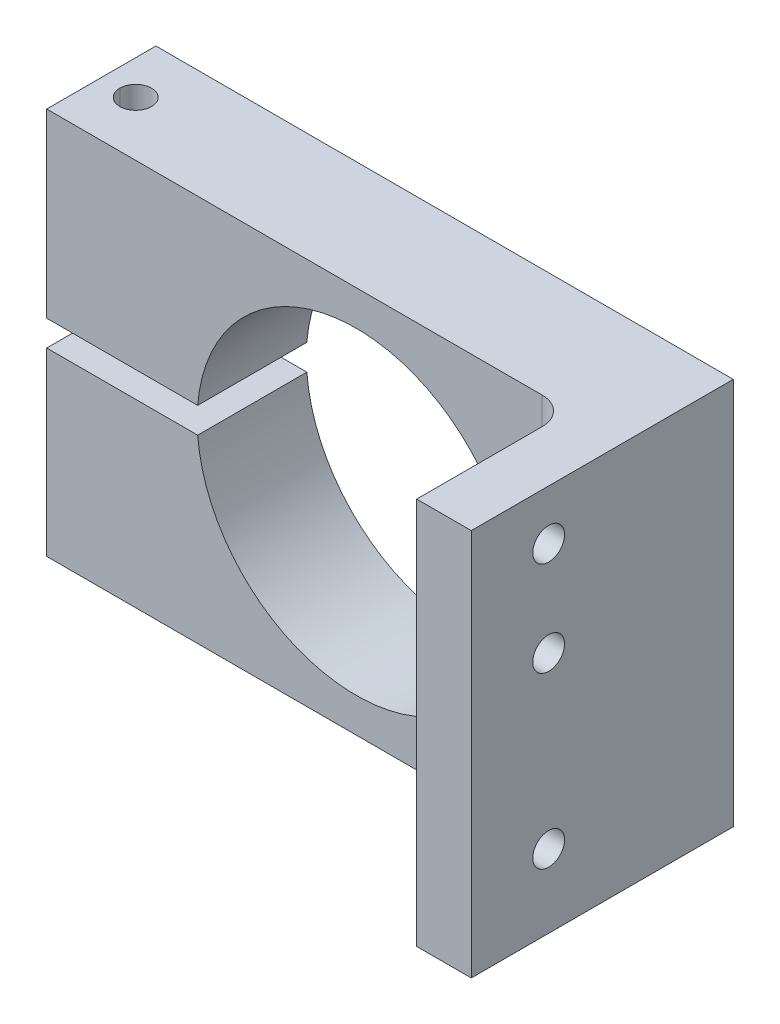
from build123d import *

# Parameters (mm, degrees)
CUT_EXTRUDE1_START       = -22.385915399
CUT_EXTRUDE1_OUTLINE_R   = 1.85
CUT_EXTRUDE1_DEPTH       = 4
CUT_EXTRUDE1_START_2     = -18.385915399
CUT_EXTRUDE1_2_OUTLINE_R = 1.85
CUT_EXTRUDE1_2_DEPTH     = 40.98
CUT_EXTRUDE1_START_3     = -12.299495873
CUT_EXTRUDE1_3_DEPTH     = 12.7
SKETCH2_W                = 30.48
SKETCH2_H                = 44.98
BOSS_EXTRUDE1_DEPTH      = 6.35
CUT_EXTRUDE2_REACH       = 69.384
SKETCH3_R                = 1.85
BOSS_EXTRUDE3_REACH      = 66.446
SKETCH4_W                = 67.174
SKETCH4_H                = 12.7
SKETCH5_W                = 6.35
SKETCH5_H                = 17.78
BOSS_EXTRUDE4_DEPTH      = 0.1
FILLET1_R                = 3.175


with BuildPart() as part:
    # Cut-Extrude1: read off the stored shape, not the designer's step
    # Cut-Extrude1 outline → Cut-Extrude1 (new body)
    with BuildSketch(Plane(origin=(0, 0, 0), x_dir=(1, 0, 0), z_dir=(0, 1, 0)).offset(CUT_EXTRUDE1_START)):
        with BuildLine():
            ThreePointArc((41.290674946, 5.949495873), (41.56736633, 6.922737878), (42.314674946, 7.604858069))
            Line((42.314674946, 7.604858069), (42.314674946, 12.299495873))
            Line((42.314674946, 12.299495873), (-24.859325054, 12.299495873))
            Line((-24.859325054, 12.299495873), (-24.859325054, -0.400504127))
            Line((-24.859325054, -0.400504127), (42.314674946, -0.400504127))
            Line((42.314674946, -0.400504127), (42.314674946, 4.294133677))
            ThreePointArc((42.314674946, 4.294133677), (41.56736633, 4.976253868), (41.290674946, 5.949495873))
        make_face()
        with Locations((-20.859325054, 5.949495873)):
            Circle(CUT_EXTRUDE1_OUTLINE_R, mode=Mode.SUBTRACT)
    extrude(amount=CUT_EXTRUDE1_DEPTH)

    # Cut-Extrude1 2 outline → Cut-Extrude1 2 (add)
    with BuildSketch(Plane(origin=(0, 0, 0), x_dir=(1, 0, 0), z_dir=(0, 1, 0)).offset(CUT_EXTRUDE1_START_2)):
        with BuildLine():
            ThreePointArc((41.290674946, 5.949495873), (41.56736633, 6.922737878), (42.314674946, 7.604858069))
            Line((42.314674946, 7.604858069), (42.314674946, 12.299495873))
            Line((42.314674946, 12.299495873), (-24.859325054, 12.299495873))
            Line((-24.859325054, 12.299495873), (-24.859325054, -0.400504127))
            Line((-24.859325054, -0.400504127), (42.314674946, -0.400504127))
            Line((42.314674946, -0.400504127), (42.314674946, 4.294133677))
            ThreePointArc((42.314674946, 4.294133677), (41.56736633, 4.976253868), (41.290674946, 5.949495873))
        make_face()
        with Locations((-20.859325054, 5.949495873)):
            Circle(CUT_EXTRUDE1_2_OUTLINE_R, mode=Mode.SUBTRACT)
    extrude(amount=CUT_EXTRUDE1_2_DEPTH)

    # Cut-Extrude1 3 outline → Cut-Extrude1 3 (cut)
    with BuildSketch(Plane.XY.offset(CUT_EXTRUDE1_START_3)):
        with BuildLine():
            Line((-7.298413969, 1.614084601), (-24.859325054, 1.614084601))
            Line((-24.859325054, 1.614084601), (-24.859325054, -1.385915399))
            Line((-24.859325054, -1.385915399), (-7.298413969, -1.385915399))
            ThreePointArc((-7.298413969, -1.385915399), (11.891293051, -18.370681356), (29.640674946, 0.114084601))
            ThreePointArc((29.640674946, 0.114084601), (11.891293051, 18.598850557), (-7.298413969, 1.614084601))
        make_face()
        with BuildLine():
            ThreePointArc((-8.270513308, 11.452345957), (-0.050086584, 19.610680621), (11.140674816, 22.594084601))
            Line((11.140674816, 22.594084601), (-24.859325054, 22.594084601))
            Line((-24.859325054, 22.594084601), (-24.859325054, 6.805102167))
            ThreePointArc((-24.859325054, 6.805102167), (-24.419985226, 7.865762339), (-23.359325054, 8.305102167))
            Line((-23.359325054, 8.305102167), (-13.753655898, 8.305102167))
            ThreePointArc((-13.753655898, 8.305102167), (-10.592564467, 9.147834154), (-8.270513308, 11.452345957))
        make_face()
        with BuildLine():
            Line((39.26266634, 0.114084601), (42.314674946, 0.114084601))
            Line((42.314674946, 0.114084601), (42.314674946, 22.594084601))
            Line((42.314674946, 22.594084601), (11.140674816, 22.594084601))
            ThreePointArc((11.140674816, 22.594084601), (25.177120317, 17.67337278), (33.068609963, 5.065454701))
            ThreePointArc((33.068609963, 5.065454701), (35.297745147, 1.504054366), (39.26266634, 0.114084601))
        make_face()
    extrude(amount=CUT_EXTRUDE1_3_DEPTH, mode=Mode.SUBTRACT)

    # Sketch2 → Boss-Extrude1 (add)
    with BuildSketch(Plane(origin=(42.314674946, 0, 0), x_dir=(0, 0, -1), z_dir=(1, 0, 0))):
        with Locations((-2.940504127, 0.104084601)):
            Rectangle(SKETCH2_W, SKETCH2_H)
    extrude(amount=-BOSS_EXTRUDE1_DEPTH)

    # Sketch3 → Cut-Extrude2 (cut, up to next)
    with BuildSketch(Plane.ZY.offset(-35.964674946), mode=Mode.PRIVATE) as cut_extrude2_sk1:
        with Locations(Location((9.177002591, 16.869259883, 0), (0, 0, 270))):
            Circle(SKETCH3_R)
    cut_extrude2_tool1 = extrude(cut_extrude2_sk1.sketch, amount=-CUT_EXTRUDE2_REACH, mode=Mode.PRIVATE) & part.part
    # Sketch3 → Cut-Extrude2 (cut, up to next)
    with BuildSketch(Plane.ZY.offset(-35.964674946), mode=Mode.PRIVATE) as cut_extrude2_sk2:
        with Locations(Location((9.177002591, 5.863674358, 0), (0, 0, 270))):
            Circle(SKETCH3_R)
    cut_extrude2_tool2 = extrude(cut_extrude2_sk2.sketch, amount=-CUT_EXTRUDE2_REACH, mode=Mode.PRIVATE) & part.part
    # Sketch3 → Cut-Extrude2 (cut, up to next)
    with BuildSketch(Plane.ZY.offset(-35.964674946), mode=Mode.PRIVATE) as cut_extrude2_sk3:
        with Locations(Location((9.177002591, -13.873009015, 0), (0, 0, 270))):
            Circle(SKETCH3_R)
    cut_extrude2_tool3 = extrude(cut_extrude2_sk3.sketch, amount=-CUT_EXTRUDE2_REACH, mode=Mode.PRIVATE) & part.part
    add(cut_extrude2_tool1.solids().sort_by_distance((35.964675, 16.86926, 9.177003))[0], mode=Mode.SUBTRACT)
    add(cut_extrude2_tool2.solids().sort_by_distance((35.964675, 5.863674, 9.177003))[0], mode=Mode.SUBTRACT)
    add(cut_extrude2_tool3.solids().sort_by_distance((35.964675, -13.873009, 9.177003))[0], mode=Mode.SUBTRACT)

    # Sketch4 → Boss-Extrude3 (add, up to next)
    with BuildSketch(Plane(origin=(0, 22.694084601, 0), x_dir=(1, 0, 0), z_dir=(0, 1, 0)), mode=Mode.PRIVATE) as boss_extrude3_sk1:
        with Locations((8.727674946, 5.949495873)):
            Rectangle(SKETCH4_W, SKETCH4_H)
        with BuildLine():
            ThreePointArc((-19.009325054, 5.949495873), (-20.859325054, 7.799495873), (-22.709325054, 5.949495873))
            ThreePointArc((-22.709325054, 5.949495873), (-20.859325054, 4.099495873), (-19.009325054, 5.949495873))
        make_face(mode=Mode.SUBTRACT)
    boss_extrude3_tool1 = extrude(boss_extrude3_sk1.sketch, amount=-BOSS_EXTRUDE3_REACH, mode=Mode.PRIVATE) - part.part
    add(boss_extrude3_tool1.solids().sort_by_distance((9.105332, 22.694085, -5.949496))[0])

    # Sketch5 → Boss-Extrude4 (add)
    with BuildSketch(Plane(origin=(0, 22.594084601, 0), x_dir=(1, 0, 0), z_dir=(0, 1, 0))):
        with Locations((39.139674946, -9.290504127)):
            Rectangle(SKETCH5_W, SKETCH5_H)
    extrude(amount=BOSS_EXTRUDE4_DEPTH)

    # Fillet1
    fillet1_edges = [part.edges().sort_by_distance(p)[0] for p in [
        (35.964674946, -10.674112441, 0.400504127),
    ]]
    fillet(fillet1_edges, radius=FILLET1_R)


solid = part.part
